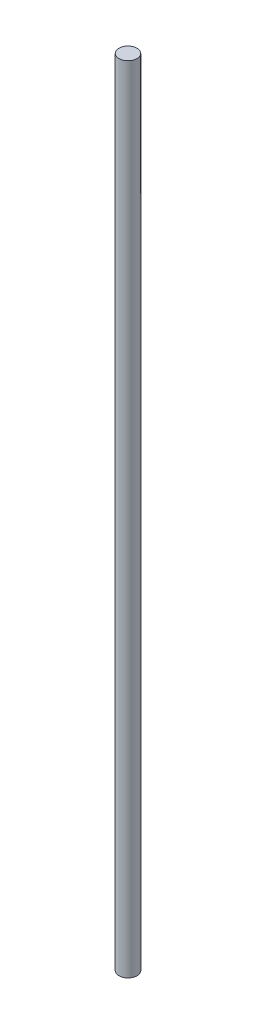
from build123d import *

# Parameters (mm, degrees)
SKETCH1_R           = 2.5
BOSS_EXTRUDE1_DEPTH = 220


with BuildPart() as part:
    # Sketch1 → Boss-Extrude1 (new body)
    with BuildSketch(Plane(origin=(0, 0, 0), x_dir=(1, 0, 0), z_dir=(0, 1, 0))):
        Circle(SKETCH1_R)
    extrude(amount=BOSS_EXTRUDE1_DEPTH)


solid = part.part
